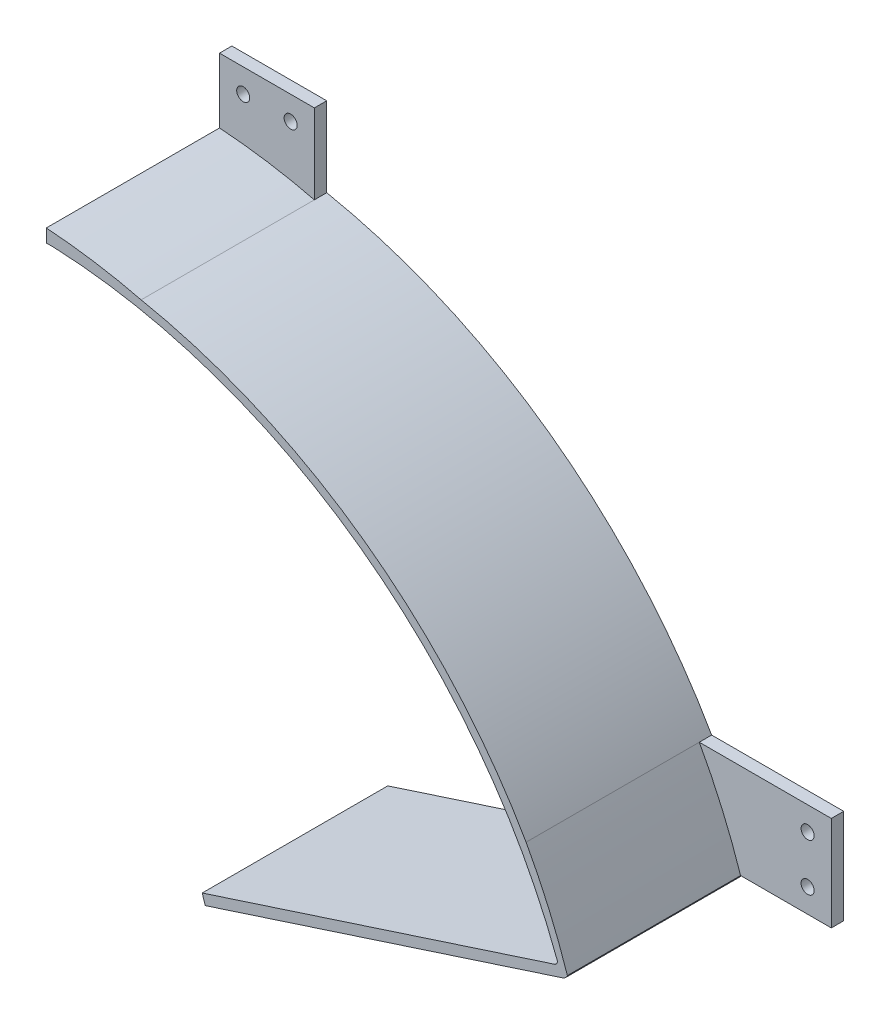
from build123d import *

# Parameters (mm, degrees)
SKETCH_1_R          = 2.6356377382591165
SKETCH_1_R_2        = 2.6356377382590894
SKETCH_1_R_3        = 2.6356377382590765
SKETCH_1_R_4        = 2.635637738259072
EXTRUDE_1_DEPTH     = 5
EXTRUDE_START       = -50
EXTRUDE_2_DEPTH     = 50
FILLET_1_R          = 3
EXTRUDE_START_2     = -70
EXTRUDE_3_DEPTH     = 70
FILLET_2_R          = 3
EXTRUDE_4_DEPTH     = 70
SKETCH_5_W          = 89.0633311885125
SKETCH_5_H          = 295.3242731829526
CUT_EXTRUDE_1_DEPTH = 275.0000000000001


with BuildPart() as part:
    # 스케치1 → 보스-돌출1 (new body)
    with BuildSketch(Plane.XY):
        with BuildLine():
            Line((-161.90972688439834, -132.69604313286513), (-19.251249440125157, -86.34349397662291))
            Line((-19.251249440125157, -86.34349397662291), (21.87942689934009, -86.34349397662294))
            Line((21.87942689934009, -86.34349397662294), (21.87942689934009, -48.00694505649064))
            Line((21.87942689934009, -48.00694505649064), (-33.73868544416714, -48.00694505649063))
            ThreePointArc((-33.73868544416714, -48.00694505649063), (-98.53802186230143, 23.53498808064043), (-187.05476471538051, 62.031590942583435))
            Line((-187.05476471538051, 62.031590942583435), (-187.05476471538051, 96.21524094975992))
            Line((-187.05476471538051, 96.21524094975992), (-225.3913136355128, 96.21524094975996))
            Line((-225.3913136355128, 96.21524094975996), (-225.3913136355128, 64.75798291501623))
            Line((-225.3913136355128, 64.75798291501623), (-222.25805676193863, 64.75798291501623))
            ThreePointArc((-222.25805676193863, 64.75798291501623), (-98.36294899741762, 21.51708345847385), (-18.952715979656908, -82.95199333393413))
            ThreePointArc((-18.952715979656908, -82.95199333393413), (-19.008196216614675, -84.1549577478759), (-19.915396046499477, -84.94691097033295))
            Line((-19.915396046499477, -84.94691097033295), (-162.3835926892786, -131.2376341463548))
            Line((-162.3835926892786, -131.2376341463548), (-161.90972688439834, -132.69604313286513))
        make_face()
        with Locations((-215.8071764054797, 86.63110371972729)):
            Circle(SKETCH_1_R, mode=Mode.SUBTRACT)
        with Locations((-196.63890194541358, 86.6311037197273)):
            Circle(SKETCH_1_R_2, mode=Mode.SUBTRACT)
        with Locations((12.295289669307014, -76.75935674658983)):
            Circle(SKETCH_1_R_3, mode=Mode.SUBTRACT)
        with Locations((12.295289669307014, -57.5910822865237)):
            Circle(SKETCH_1_R_4, mode=Mode.SUBTRACT)
    extrude(amount=EXTRUDE_1_DEPTH)

    # 스케치2 → 보스-돌출2 (add)
    with BuildSketch(Plane.XY.offset(5).offset(EXTRUDE_START)):
        with BuildLine():
            Line((-161.90972688439834, -132.69604313286513), (-19.25124944012515, -86.34349397662291))
            Line((-19.251249440125157, -86.34349397662291), (-17.716653821091654, -86.34349397662291))
            ThreePointArc((-17.71665382109279, -86.34349397662707), (-18.32795901714934, -84.64529234814141), (-18.952715979656915, -82.95199333393413))
            ThreePointArc((-18.95271597965692, -82.95199333393413), (-19.008196216614667, -84.1549577478759), (-19.915396046499477, -84.94691097033295))
            Line((-19.915396046499477, -84.94691097033295), (-162.3835926892786, -131.2376341463548))
            Line((-162.3835926892786, -131.2376341463548), (-161.90972688439834, -132.69604313286513))
        make_face()
        with BuildLine():
            ThreePointArc((-18.952715979656915, -82.95199333393413), (-18.32795901714934, -84.64529234814141), (-17.71665382109279, -86.34349397662707))
            Line((-17.716653821091654, -86.34349397662291), (-16.089863152321414, -86.34349397662291))
            ThreePointArc((-16.08986315232295, -86.34349397662834), (-24.029465542915716, -66.76788414274672), (-33.7386854441672, -48.006945056490636))
            ThreePointArc((-33.7386854441672, -48.006945056490636), (-98.53802186230149, 23.53498808064043), (-187.0547647153805, 62.03159094258342))
            ThreePointArc((-187.0547647153805, 62.03159094258342), (-206.13076342964123, 65.02753015483808), (-225.39131363551047, 66.40614702590713))
            Line((-225.3913136355128, 66.4061470259071), (-225.3913136355128, 64.87202248366495))
            ThreePointArc((-225.3913136355129, 64.87202248366495), (-223.82448876300626, 64.82039980470964), (-222.25805676193858, 64.75798291501621))
            ThreePointArc((-222.25805676193858, 64.75798291501621), (-98.36294899741759, 21.51708345847382), (-18.952715979656915, -82.95199333393413))
        make_face()
    extrude(amount=EXTRUDE_2_DEPTH)

    # 필렛1
    # the kernel refuses this fillet: 3 mm, written as the material it takes off along each edge
    with BuildSketch(Plane(origin=(-16.089863152324853, -86.34349397662284, -55.26319649463599), x_dir=(-0.3411564748454367, 0.9400065210789948, 0), z_dir=(0, 0, 1))) as fillet_1_piece_1:
        with BuildLine():
            CenterArc((4.078395273634998, 2.9998795453949634), FILLET_1_R, 180.53774443113053, 89.97569611298013)
            Line((1.0785274015705548, 2.971723726182023), (0, 0))
            ThreePointArc((0, 0), (2.052639298925323, -0.00919714593498524), (4.105278597850862, -9e-17))
        make_face()
    extrude(amount=55.26319649463599, mode=Mode.SUBTRACT)

    # 스케치3 → 보스-돌출3 (add)
    with BuildSketch(Plane.XY.offset(5).offset(EXTRUDE_START_2)):
        with BuildLine():
            Line((-19.25124944012515, -86.34349397662291), (-161.90972688439834, -132.69604313286513))
            Line((-161.90972688439834, -132.69604313286513), (-161.14752471177883, -135.0418602115354))
            Line((-161.14752471177883, -135.0418602115354), (-13.733764686030042, -87.14422608341849))
            ThreePointArc((-13.73376468603007, -87.1442260834185), (-13.872485363120319, -86.74373244280719), (-14.011940562426247, -86.34349397662855))
            Line((-14.011940562424655, -86.34349397662291), (-19.251249440125157, -86.34349397662291))
        make_face()
        with BuildLine():
            Line((-33.738685444167196, -48.00694505649064), (-31.477883861441427, -48.00694505649064))
            ThreePointArc((-31.477883861440404, -48.00694505648765), (-97.09546483661316, 24.91254341428484), (-187.05476471538535, 64.03086517268349))
            Line((-187.05476471538051, 64.03086517268437), (-187.05476471538051, 62.03159094258343))
            ThreePointArc((-187.0547647153805, 62.03159094258345), (-98.53802186230146, 23.53498808064043), (-33.738685444167174, -48.00694505649062))
        make_face()
        with BuildLine():
            Line((-162.3835926892786, -131.2376341463548), (-161.90972688439834, -132.69604313286513))
            Line((-161.90972688439834, -132.69604313286513), (-19.25124944012515, -86.34349397662291))
            Line((-19.251249440125157, -86.34349397662291), (-14.011940562424655, -86.34349397662291))
            ThreePointArc((-14.011940562426247, -86.34349397662855), (-21.86923355209842, -66.77626462229537), (-31.477883861440404, -48.00694505648765))
            Line((-31.477883861441427, -48.00694505649064), (-33.738685444167196, -48.00694505649064))
            ThreePointArc((-33.738685444167174, -48.00694505649062), (-98.53802186230146, 23.53498808064043), (-187.0547647153805, 62.03159094258345))
            Line((-187.05476471538051, 62.03159094258343), (-187.05476471538051, 64.03086517268437))
            ThreePointArc((-187.05476471538535, 64.03086517268349), (-206.13235139969905, 67.00089307897522), (-225.3913136355111, 68.36755070296968))
            Line((-225.3913136355128, 68.36755070296962), (-225.3913136355128, 64.75798291501623))
            Line((-225.3913136355128, 64.75798291501623), (-222.2580567619386, 64.75798291501621))
            ThreePointArc((-222.2580567619386, 64.75798291501624), (-98.36294899741762, 21.51708345847382), (-18.952715979656915, -82.95199333393413))
            ThreePointArc((-18.95271597965692, -82.95199333393413), (-19.008196216614667, -84.1549577478759), (-19.915396046499477, -84.94691097033295))
            Line((-19.915396046499477, -84.94691097033295), (-162.3835926892786, -131.2376341463548))
        make_face()
    extrude(amount=EXTRUDE_3_DEPTH)

    # 필렛2
    fillet_2_edges = [part.edges().sort_by_distance(p)[0] for p in [
        (-13.733764686030042, -87.14422608341849, -30),
    ]]
    fillet(fillet_2_edges, radius=FILLET_2_R)

    # 스케치4 → 보스-돌출4 (add)
    with BuildSketch(Plane.XY.offset(5)):
        with BuildLine():
            ThreePointArc((-16.659298654257338, -88.09478969169395), (-15.531728736228363, -87.42760572202484), (-14.796031724606808, -86.34349397662291))
            ThreePointArc((-14.796031724606877, -86.34349397662292), (-22.25453577932595, -66.79124041647023), (-31.477883861438727, -48.006945056490636))
            ThreePointArc((-31.4778838614387, -48.006945056490636), (-97.09546483660972, 24.912543414282396), (-187.05476471538054, 64.03086517268255))
            ThreePointArc((-187.0547647153805, 64.03086517268252), (-206.09486736019076, 67.8503266656956), (-225.3913136355128, 70.03228816057364))
            Line((-225.3913136355128, 70.03228816057364), (-225.3913136355128, 64.75798291501623))
            Line((-225.3913136355128, 64.75798291501623), (-222.2580567619386, 64.75798291501621))
            ThreePointArc((-222.2580567619386, 64.75798291501624), (-98.36294899741762, 21.51708345847382), (-18.952715979656915, -82.95199333393413))
            ThreePointArc((-18.95271597965692, -82.95199333393413), (-19.008196216614667, -84.1549577478759), (-19.915396046499477, -84.94691097033295))
            Line((-19.915396046499477, -84.94691097033295), (-162.3835926892786, -131.2376341463548))
            Line((-162.3835926892786, -131.2376341463548), (-161.14752471177886, -135.0418602115354))
            Line((-161.14752471177886, -135.0418602115354), (-16.659298654257327, -88.09478969169395))
        make_face()
    extrude(amount=EXTRUDE_4_DEPTH)

    # 스케치5 → 컷-돌출1 (cut)
    with BuildSketch(Plane.ZY.offset(225.3913136355128)):
        with Locations((-44.53166559425625, -79.29458588850659)):
            Rectangle(SKETCH_5_W, SKETCH_5_H)
    extrude(amount=-CUT_EXTRUDE_1_DEPTH, mode=Mode.SUBTRACT)


solid = part.part
